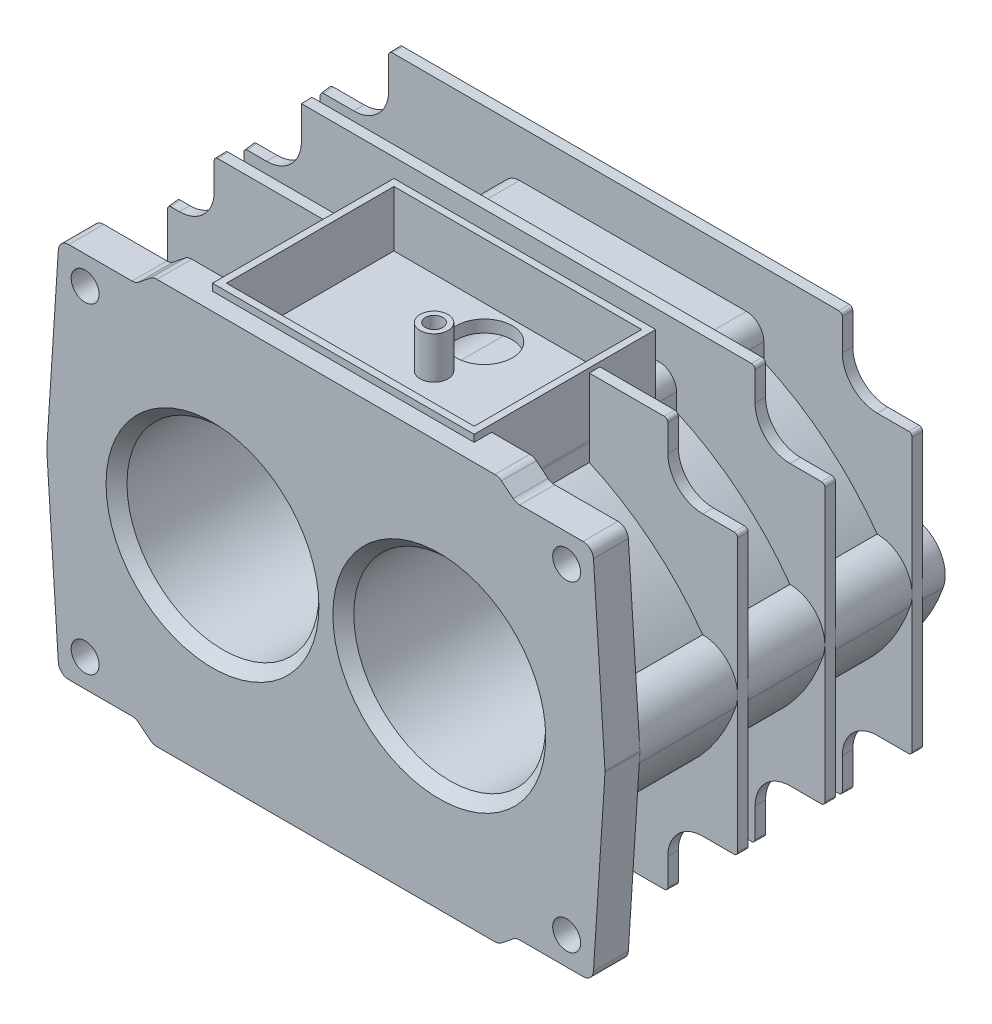
from build123d import *

# Parameters (mm, degrees)
SCHIZZO1_R                    = 27.5
SCHIZZO1_R_2                  = 4
ESTRUSIONE_ESTRUSIONE1_DEPTH  = 10
ESTRUSIONE_ESTRUSIONE2_DEPTH  = 87.5
SMUSSO1_SIZE                  = 3
SCHIZZO14_W                   = 170
SCHIZZO14_H                   = 120
ESTRUSIONE_ESTRUSIONE11_DEPTH = 3
RIPETIZIONE_A_L1_COUNT        = 3
RIPETIZIONE_A_L1_PITCH        = 25
TAGLIO_ESTRUSIONE2_DEPTH      = 62
FORO_FILETTATO_M8_1_D         = 6.8
FORO_FILETTATO_M8_1_DEPTH     = 35
FORO_FILETTATO_M8_1_TIP       = 2.042926105
SCHIZZO5_R                    = 27.5
TAGLIO_ESTRUSIONE3_DEPTH      = 197
TAGLIO_ESTRUSIONE4_DEPTH      = 197
TAGLIO_ESTRUSIONE4_DEPTH_BACK = 197
TAGLIO_ESTRUSIONE5_DEPTH      = 197
TAGLIO_ESTRUSIONE5_DEPTH_BACK = 197
SCHIZZO18_W                   = 75
SCHIZZO18_H                   = 52
ESTRUSIONE_ESTRUSIONE12_DEPTH = 18
SCHIZZO19_W                   = 71
SCHIZZO19_H                   = 48
TAGLIO_ESTRUSIONE6_DEPTH      = 16
ESTRUSIONE_ESTRUSIONE13_DEPTH = 3
RIPETIZIONE_A_L2_COUNT        = 3
RIPETIZIONE_A_L2_PITCH        = 25
SCHIZZO21_R                   = 14
ESTRUSIONE_ESTRUSIONE17_DEPTH = 13.5
TAGLIO_ESTRUSIONE7_DEPTH      = 75
FORO_FILETTATO_M24_1_D        = 21
FORO_FILETTATO_M24_1_DEPTH    = 25
FORO_FILETTATO_M24_1_TIP      = 6.3090365
SCHIZZO26_R                   = 4
ESTRUSIONE_ESTRUSIONE18_DEPTH = 12
FORO_FILETTATO_M6_1_D         = 5
FORO_FILETTATO_M6_1_DEPTH     = 12
FORO_FILETTATO_M6_1_TIP       = 1.502151548
SCHIZZO28_R                   = 8
TAGLIO_ESTRUSIONE8_DEPTH      = 12
RACCORDO11_R                  = 1
RACCORDO14_R                  = 2
RACCORDO15_R                  = 2


with BuildPart() as part:
    # Schizzo1 → Estrusione-Estrusione1 (new body)
    with BuildSketch(Plane.XY):
        with BuildLine():
            Line((-48.447656822, -58), (48.447656822, -58))
            ThreePointArc((48.447656822, -58), (49.440677646, -57.830884957), (50.321741965, -57.342606428))
            Line((50.321741965, -57.342606428), (53.678258035, -54.657393572))
            ThreePointArc((53.678258035, -54.657393572), (54.559322354, -54.169115043), (55.552343178, -54))
            Line((55.552343178, -54), (73.688149608, -54))
            ThreePointArc((73.688149608, -54), (75.739720726, -53.188848088), (76.681867953, -51.1940373))
            Line((76.681867953, -51.1940373), (79.987423508, -0.1940373))
            ThreePointArc((79.987423508, -0.1940373), (79.993705164, 0), (79.987423508, 0.1940373))
            Line((79.987423508, 0.1940373), (76.681867953, 51.1940373))
            ThreePointArc((76.681867953, 51.1940373), (75.739720726, 53.188848088), (73.688149608, 54))
            Line((73.688149608, 54), (55.552343178, 54))
            ThreePointArc((55.552343178, 54), (54.559322354, 54.169115043), (53.678258035, 54.657393572))
            Line((53.678258035, 54.657393572), (50.321741965, 57.342606428))
            ThreePointArc((50.321741965, 57.342606428), (49.440677646, 57.830884957), (48.447656822, 58))
            Line((48.447656822, 58), (-48.447656822, 58))
            ThreePointArc((-48.447656822, 58), (-49.440677646, 57.830884957), (-50.321741965, 57.342606428))
            Line((-50.321741965, 57.342606428), (-53.678258035, 54.657393572))
            ThreePointArc((-53.678258035, 54.657393572), (-54.559322354, 54.169115043), (-55.552343178, 54))
            Line((-55.552343178, 54), (-73.688149608, 54))
            ThreePointArc((-73.688149608, 54), (-75.739720726, 53.188848088), (-76.681867953, 51.1940373))
            Line((-76.681867953, 51.1940373), (-79.987423508, 0.1940373))
            ThreePointArc((-79.987423508, 0.1940373), (-79.993705164, 0), (-79.987423508, -0.1940373))
            Line((-79.987423508, -0.1940373), (-76.681867953, -51.1940373))
            ThreePointArc((-76.681867953, -51.1940373), (-75.739720726, -53.188848088), (-73.688149608, -54))
            Line((-73.688149608, -54), (-55.552343178, -54))
            ThreePointArc((-55.552343178, -54), (-54.559322354, -54.169115043), (-53.678258035, -54.657393572))
            Line((-53.678258035, -54.657393572), (-50.321741965, -57.342606428))
            ThreePointArc((-50.321741965, -57.342606428), (-49.440677646, -57.830884957), (-48.447656822, -58))
        make_face()
        with Locations((-32.5, 0)):
            Circle(SCHIZZO1_R, mode=Mode.SUBTRACT)
        with Locations((32.5, 0)):
            Circle(SCHIZZO1_R, mode=Mode.SUBTRACT)
        with Locations((-69, 46)):
            Circle(SCHIZZO1_R_2, mode=Mode.SUBTRACT)
        with Locations((-69, -46)):
            Circle(SCHIZZO1_R_2, mode=Mode.SUBTRACT)
        with Locations((69, -46)):
            Circle(SCHIZZO1_R_2, mode=Mode.SUBTRACT)
        with Locations((69, 46)):
            Circle(SCHIZZO1_R_2, mode=Mode.SUBTRACT)
    extrude(amount=-ESTRUSIONE_ESTRUSIONE1_DEPTH)

    # Schizzo3 → Estrusione-Estrusione2 (add)
    with BuildSketch(Plane.XY.offset(-97.5)):
        with BuildLine():
            Line((32.5, 46.5), (-32.5, 46.5))
            ThreePointArc((-32.5, 46.5), (-36.035533906, 45.035533906), (-37.5, 41.5))
            Line((-37.5, 41.5), (-37.5, 36.5))
            ThreePointArc((-37.5, 36.5), (-55.517237648, 25.417366926), (-70, 10))
            ThreePointArc((-70, 10), (-78.156554434, 5.785379829), (-79.437753099, -3.305876047))
            ThreePointArc((-79.437753099, -3.305876047), (-63.2803434, -25.981788278), (-37.5, -36.5))
            Line((-37.5, -36.5), (-37.5, -41.5))
            ThreePointArc((-37.5, -41.5), (-36.035533906, -45.035533906), (-32.5, -46.5))
            Line((-32.5, -46.5), (32.5, -46.5))
            ThreePointArc((32.5, -46.5), (36.035533906, -45.035533906), (37.5, -41.5))
            Line((37.5, -41.5), (37.5, -36.5))
            ThreePointArc((37.5, -36.5), (63.2803434, -25.981788278), (79.437753099, -3.305876047))
            ThreePointArc((79.437753099, -3.305876047), (78.156554434, 5.785379829), (70, 10))
            ThreePointArc((70, 10), (55.517237648, 25.417366926), (37.5, 36.5))
            Line((37.5, 36.5), (37.5, 41.5))
            ThreePointArc((37.5, 41.5), (36.035533906, 45.035533906), (32.5, 46.5))
        make_face()
    extrude(amount=ESTRUSIONE_ESTRUSIONE2_DEPTH)

    # Smusso1
    smusso1_edges = [part.edges().sort_by_distance(p)[0] for p in [
        (-60, 0, 0),
        (5, 0, 0),
    ]]
    chamfer(smusso1_edges, length=SMUSSO1_SIZE)

    # Schizzo14 → Estrusione-Estrusione11 (add)
    with BuildSketch(Plane.XY.offset(-91)):
        with Locations((-5, 0)):
            Rectangle(SCHIZZO14_W, SCHIZZO14_H)
    estrusione_estrusione11 = extrude(amount=ESTRUSIONE_ESTRUSIONE11_DEPTH)

    # Ripetizione a L1: Estrusione-Estrusione11 ×3
    with Locations(*[(0, 0, i * RIPETIZIONE_A_L1_PITCH) for i in range(1, RIPETIZIONE_A_L1_COUNT)]):
        add(estrusione_estrusione11)

    # Schizzo15 → Taglio-Estrusione2 (cut)
    with BuildSketch(Plane(origin=(0, 0, -91), x_dir=(-1, 0, 0), z_dir=(0, 0, -1))):
        with BuildLine():
            Line((-70, -40), (-80, -40))
            Line((-80, -40), (-80, -60))
            Line((-80, -60), (-60, -60))
            Line((-60, -60), (-60, -50))
            ThreePointArc((-60, -50), (-62.928932188, -42.928932188), (-70, -40))
        make_face()
        with BuildLine():
            Line((-60, 60), (-80, 60))
            Line((-80, 60), (-80, 40))
            Line((-80, 40), (-70, 40))
            ThreePointArc((-70, 40), (-62.928932188, 42.928932188), (-60, 50))
            Line((-60, 50), (-60, 60))
        make_face()
        with BuildLine():
            Line((90, -40), (80, -40))
            ThreePointArc((80, -40), (72.928932188, -42.928932188), (70, -50))
            Line((70, -50), (70, -60))
            Line((70, -60), (90, -60))
            Line((90, -60), (90, -40))
        make_face()
        with BuildLine():
            Line((70, 60), (90, 60))
            Line((90, 60), (90, 40))
            Line((90, 40), (80, 40))
            ThreePointArc((80, 40), (72.928932188, 42.928932188), (70, 50))
            Line((70, 50), (70, 60))
        make_face()
    extrude(amount=-TAGLIO_ESTRUSIONE2_DEPTH, mode=Mode.SUBTRACT)

    # Foro filettato M8-1
    with Locations(Plane(origin=(-28.5, -37.5, -97.5), x_dir=(-1, 0, 0), z_dir=(0, 0, -1))):
        with Locations((0, 0), (0, 75), (-57, 75), (-57, 0), (-98.5, 37.5), (41.5, 37.5)):
            Hole(FORO_FILETTATO_M8_1_D / 2, depth=FORO_FILETTATO_M8_1_DEPTH)
            with Locations((0, 0, -(FORO_FILETTATO_M8_1_DEPTH + FORO_FILETTATO_M8_1_TIP / 2))):  # 118° drill point
                Cone(0, FORO_FILETTATO_M8_1_D / 2, FORO_FILETTATO_M8_1_TIP, mode=Mode.SUBTRACT)

    # Schizzo5 → Taglio-Estrusione3 (cut)
    with BuildSketch(Plane.XY):
        with Locations((-32.5, 0)):
            Circle(SCHIZZO5_R)
        with Locations((32.5, 0)):
            Circle(SCHIZZO5_R)
    extrude(amount=-TAGLIO_ESTRUSIONE3_DEPTH, mode=Mode.SUBTRACT)

    # Schizzo16 → Taglio-Estrusione4 (cut, two sides: drawn at the far end of the back side and taken through both)
    with BuildSketch(Plane(origin=(0, 0, 0), x_dir=(1, 0, 0), z_dir=(0, 1, 0)).offset(-TAGLIO_ESTRUSIONE4_DEPTH_BACK)):
        with BuildLine():
            Line((-90, 91), (-79.91633228, 10))
            ThreePointArc((-79.91633228, 10), (-104.308981433, 48.091022327), (-90, 91))
        make_face()
    extrude(amount=TAGLIO_ESTRUSIONE4_DEPTH + TAGLIO_ESTRUSIONE4_DEPTH_BACK, mode=Mode.SUBTRACT)

    # Schizzo17 → Taglio-Estrusione5 (cut, two sides: drawn at the far end of the back side and taken through both)
    with BuildSketch(Plane(origin=(0, 0, 0), x_dir=(0, 0, -1), z_dir=(1, 0, 0)).offset(-TAGLIO_ESTRUSIONE5_DEPTH_BACK)):
        with BuildLine():
            Line((91, 60), (10, 58))
            ThreePointArc((10, 58), (50.02100618, 78.399249701), (91, 60))
        make_face()
        with BuildLine():
            Line((91, -60), (10, -58))
            ThreePointArc((10, -58), (50.02100618, -78.399249701), (91, -60))
        make_face()
    extrude(amount=TAGLIO_ESTRUSIONE5_DEPTH + TAGLIO_ESTRUSIONE5_DEPTH_BACK, mode=Mode.SUBTRACT)

    # Schizzo18 → Estrusione-Estrusione12 (add)
    with BuildSketch(Plane(origin=(0, 60, 0), x_dir=(1, 0, 0), z_dir=(0, 1, 0))):
        with Locations((0, 31)):
            Rectangle(SCHIZZO18_W, SCHIZZO18_H)
    extrude(amount=-ESTRUSIONE_ESTRUSIONE12_DEPTH)

    # Schizzo19 → Taglio-Estrusione6 (cut)
    with BuildSketch(Plane(origin=(0, 60, 0), x_dir=(1, 0, 0), z_dir=(0, 1, 0))):
        with Locations((0, 31)):
            Rectangle(SCHIZZO19_W, SCHIZZO19_H)
    extrude(amount=-TAGLIO_ESTRUSIONE6_DEPTH, mode=Mode.SUBTRACT)

    # Schizzo20 → Estrusione-Estrusione13 (add)
    with BuildSketch(Plane.XY.offset(-78.5)):
        with BuildLine():
            Line((30, -46.5), (-30, -46.5))
            Line((-30, -46.5), (-30, -49.5))
            ThreePointArc((-30, -49.5), (-28.535533906, -53.035533906), (-25, -54.5))
            Line((-25, -54.5), (25, -54.5))
            ThreePointArc((25, -54.5), (28.535533906, -53.035533906), (30, -49.5))
            Line((30, -49.5), (30, -46.5))
        make_face()
    estrusione_estrusione13 = extrude(amount=ESTRUSIONE_ESTRUSIONE13_DEPTH)

    # Ripetizione a L2: Estrusione-Estrusione13 ×3
    with Locations(*[(0, 0, i * RIPETIZIONE_A_L2_PITCH) for i in range(1, RIPETIZIONE_A_L2_COUNT)]):
        add(estrusione_estrusione13)

    # Schizzo21 → Estrusione-Estrusione17 (add)
    with BuildSketch(Plane(origin=(0, -60, 0), x_dir=(1, 0, 0), z_dir=(0, 1, 0))):
        with Locations(Location((0, 24.5, 0), (0, 0, 105.358885581))):
            Circle(SCHIZZO21_R)
    extrude(amount=ESTRUSIONE_ESTRUSIONE17_DEPTH)

    # Schizzo22 → Taglio-Estrusione7 (cut)
    with BuildSketch(Plane(origin=(0, 0, -97.5), x_dir=(-1, 0, 0), z_dir=(0, 0, -1))):
        with BuildLine():
            Line((-14.257337925, 40.5), (14.257337925, 40.5))
            ThreePointArc((14.257337925, 40.5), (18.31801322, 38.81801322), (20, 34.757337925))
            Line((20, 34.757337925), (20, 34.242662075))
            ThreePointArc((20, 34.242662075), (18.31801322, 30.18198678), (14.257337925, 28.5))
            Line((14.257337925, 28.5), (-14.257337925, 28.5))
            ThreePointArc((-14.257337925, 28.5), (-18.31801322, 30.18198678), (-20, 34.242662075))
            Line((-20, 34.242662075), (-20, 34.757337925))
            ThreePointArc((-20, 34.757337925), (-18.31801322, 38.81801322), (-14.257337925, 40.5))
        make_face()
        with BuildLine():
            Line((-15, -40.5), (15, -40.5))
            ThreePointArc((15, -40.5), (18.535533906, -39.035533906), (20, -35.5))
            Line((20, -35.5), (20, -34.292856399))
            ThreePointArc((20, -34.292856399), (19.264014327, -31.68169156), (17.272727273, -29.839238685))
            ThreePointArc((17.272727273, -29.839238685), (8.948926939, -23.824293434), (2.838375937, -15.570422535))
            ThreePointArc((2.838375937, -15.570422535), (2.102144972, -14.788399151), (1.067532709, -14.5))
            Line((1.067532709, -14.5), (-1.067532709, -14.5))
            ThreePointArc((-1.067532709, -14.5), (-2.102144972, -14.788399151), (-2.838375937, -15.570422535))
            ThreePointArc((-2.838375937, -15.570422535), (-8.948926939, -23.824293434), (-17.272727273, -29.839238685))
            ThreePointArc((-17.272727273, -29.839238685), (-19.264014327, -31.68169156), (-20, -34.292856399))
            Line((-20, -34.292856399), (-20, -35.5))
            ThreePointArc((-20, -35.5), (-18.535533906, -39.035533906), (-15, -40.5))
        make_face()
    extrude(amount=-TAGLIO_ESTRUSIONE7_DEPTH, mode=Mode.SUBTRACT)

    # Foro filettato M24-1
    with Locations(Plane(origin=(0, -60, -24.5), x_dir=(0, 0, -1), z_dir=(0, -1, 0))):
        with Locations((0, 0)):
            Hole(FORO_FILETTATO_M24_1_D / 2, depth=FORO_FILETTATO_M24_1_DEPTH)
            with Locations((0, 0, -(FORO_FILETTATO_M24_1_DEPTH + FORO_FILETTATO_M24_1_TIP / 2))):  # 118° drill point
                Cone(0, FORO_FILETTATO_M24_1_D / 2, FORO_FILETTATO_M24_1_TIP, mode=Mode.SUBTRACT)

    # Schizzo26 → Estrusione-Estrusione18 (add)
    with BuildSketch(Plane(origin=(0, 44, 0), x_dir=(1, 0, 0), z_dir=(0, 1, 0))):
        with Locations(Location((0, 31, 0), (0, 0, 270))):
            Circle(SCHIZZO26_R)
    extrude(amount=ESTRUSIONE_ESTRUSIONE18_DEPTH)

    # Foro filettato M6-1
    with Locations(Plane(origin=(0, 56, -31), x_dir=(0, 0, 1), z_dir=(0, 1, 0))):
        with Locations((0, 0)):
            Hole(FORO_FILETTATO_M6_1_D / 2, depth=FORO_FILETTATO_M6_1_DEPTH)
            with Locations((0, 0, -(FORO_FILETTATO_M6_1_DEPTH + FORO_FILETTATO_M6_1_TIP / 2))):  # 118° drill point
                Cone(0, FORO_FILETTATO_M6_1_D / 2, FORO_FILETTATO_M6_1_TIP, mode=Mode.SUBTRACT)

    # Schizzo28 → Taglio-Estrusione8 (cut)
    with BuildSketch(Plane(origin=(0, 44, 0), x_dir=(1, 0, 0), z_dir=(0, 1, 0))):
        with Locations(Location((0, 45.40883374, 0), (0, 0, 270))):
            Circle(SCHIZZO28_R)
    extrude(amount=-TAGLIO_ESTRUSIONE8_DEPTH, mode=Mode.SUBTRACT)

    # Raccordo11
    raccordo11_edges = [part.edges().sort_by_distance(p)[0] for p in [
        (80, -40, -64.5),
        (80, -40, -39.5),
        (80, -40, -89.5),
        (80, 40, -64.5),
        (80, 40, -39.5),
        (80, 40, -89.5),
        (-86.701022289, 40, -64.5),
        (-83.588779166, -40, -39.5),
        (-83.588779166, 40, -39.5),
        (-86.701022289, -40, -64.5),
        (-89.813265413, -40, -89.5),
        (-89.813265413, 40, -89.5),
        (60, 58.728395062, -39.5),
        (-70, 58.728395062, -39.5),
        (60, 59.345679012, -64.5),
        (60, 59.962962963, -89.5),
        (-70, 59.962962963, -89.5),
        (-70, -59.345679012, -64.5),
        (60, -58.728395062, -39.5),
        (-70, -58.728395062, -39.5),
        (60, -59.345679012, -64.5),
        (60, -59.962962963, -89.5),
        (-70, -59.962962963, -89.5),
    ]]
    fillet(raccordo11_edges, radius=RACCORDO11_R)

    # Raccordo14
    raccordo14_edges = [part.edges().sort_by_distance(p)[0] for p in [
        (37.5, 36.5, -94.25),
        (70, 10, -94.25),
        (37.5, -36.5, -94.25),
        (-37.5, -36.5, -94.25),
        (-70, 10, -94.25),
        (-37.5, 36.5, -94.25),
    ]]
    fillet(raccordo14_edges, radius=RACCORDO14_R)

    # Raccordo15
    # the kernel refuses this fillet: 2 mm, written as the material it adds along each edge
    with BuildSketch(Plane(origin=(30, -46.5, -78.5), x_dir=(0, 0, -1), z_dir=(-1, 0, 0)), Plane(origin=(30, -46.5, -53.5), x_dir=(0, 0, -1), z_dir=(-1, 0, 0))) as raccordo15_piece_1:
        with BuildLine():
            CenterArc((RACCORDO15_R, RACCORDO15_R), RACCORDO15_R, 180, 90)
            Line((0, RACCORDO15_R), (0, 0))
            Line((0, 0), (RACCORDO15_R, 0))
        make_face()
    extrude(amount=60)
    with BuildSketch(Plane(origin=(30, -46.5, -78.5), x_dir=(1, 0, 0), z_dir=(0, 0, 1)), Plane(origin=(30, -46.5, -53.5), x_dir=(1, 0, 0), z_dir=(0, 0, 1)), Plane(origin=(30, -46.5, -28.5), x_dir=(1, 0, 0), z_dir=(0, 0, 1))) as raccordo15_piece_2:
        with BuildLine():
            CenterArc((RACCORDO15_R, -RACCORDO15_R), RACCORDO15_R, 90, 90)
            Line((0, -RACCORDO15_R), (0, 0))
            Line((0, 0), (RACCORDO15_R, 0))
        make_face()
    extrude(amount=3)
    with BuildSketch(Plane(origin=(-30, -46.5, -78.5), x_dir=(-1, 0, 0), z_dir=(0, 0, 1)), Plane(origin=(-30, -46.5, -53.5), x_dir=(-1, 0, 0), z_dir=(0, 0, 1)), Plane(origin=(-30, -46.5, -28.5), x_dir=(-1, 0, 0), z_dir=(0, 0, 1))) as raccordo15_piece_3:
        with BuildLine():
            CenterArc((RACCORDO15_R, RACCORDO15_R), RACCORDO15_R, 180, 90)
            Line((0, RACCORDO15_R), (0, 0))
            Line((0, 0), (RACCORDO15_R, 0))
        make_face()
    extrude(amount=3)
    with BuildSketch(Plane(origin=(30, -46.5, -75.5), x_dir=(0, 0, 1), z_dir=(-1, 0, 0)), Plane(origin=(30, -46.5, -50.5), x_dir=(0, 0, 1), z_dir=(-1, 0, 0))) as raccordo15_piece_4:
        with BuildLine():
            CenterArc((RACCORDO15_R, -RACCORDO15_R), RACCORDO15_R, 90, 90)
            Line((0, -RACCORDO15_R), (0, 0))
            Line((0, 0), (RACCORDO15_R, 0))
        make_face()
    extrude(amount=60)
    with BuildSketch(Plane(origin=(30, -46.5, -28.5), x_dir=(0, 0, -1), z_dir=(-1, 0, 0))) as raccordo15_piece_5_section:
        with BuildLine():
            CenterArc((RACCORDO15_R, RACCORDO15_R), RACCORDO15_R, 180, 90)
            Line((0, RACCORDO15_R), (0, 0))
            Line((0, 0), (RACCORDO15_R, 0))
        make_face()
    raccordo15_piece_5 = extrude(amount=21.583592135, mode=Mode.PRIVATE)
    raccordo15_piece_5 = raccordo15_piece_5 - Plane(origin=(0, -46.5, -24.5), x_dir=(-0.2648642316849714, 0, -0.9642857142848948), z_dir=(0, -1, 0)) * Cylinder(14, 52, mode=Mode.PRIVATE)
    add(raccordo15_piece_5)
    with BuildSketch(Plane(origin=(30, -46.5, -25.5), x_dir=(0, 0, 1), z_dir=(-1, 0, 0))) as raccordo15_piece_6_section:
        with BuildLine():
            CenterArc((RACCORDO15_R, -RACCORDO15_R), RACCORDO15_R, 90, 90)
            Line((0, -RACCORDO15_R), (0, 0))
            Line((0, 0), (RACCORDO15_R, 0))
        make_face()
    raccordo15_piece_6 = extrude(amount=21.035759956, mode=Mode.PRIVATE)
    raccordo15_piece_6 = raccordo15_piece_6 - Plane(origin=(0, -46.5, -24.5), x_dir=(-0.2648642316849714, 0, -0.9642857142848948), z_dir=(0, -1, 0)) * Cylinder(14, 51, mode=Mode.PRIVATE)
    add(raccordo15_piece_6)
    with BuildSketch(Plane(origin=(-8.416407865, -46.5, -28.5), x_dir=(0, 0, -1), z_dir=(-1, 0, 0))) as raccordo15_piece_7_section:
        with BuildLine():
            CenterArc((RACCORDO15_R, RACCORDO15_R), RACCORDO15_R, 180, 90)
            Line((0, RACCORDO15_R), (0, 0))
            Line((0, 0), (RACCORDO15_R, 0))
        make_face()
    raccordo15_piece_7 = extrude(amount=21.583592135, mode=Mode.PRIVATE)
    raccordo15_piece_7 = raccordo15_piece_7 - Plane(origin=(0, -46.5, -24.5), x_dir=(-0.2648642316849714, 0, -0.9642857142848948), z_dir=(0, -1, 0)) * Cylinder(14, 52, mode=Mode.PRIVATE)
    add(raccordo15_piece_7)
    with BuildSketch(Plane(origin=(-8.964240044, -46.5, -25.5), x_dir=(0, 0, 1), z_dir=(-1, 0, 0))) as raccordo15_piece_8_section:
        with BuildLine():
            CenterArc((RACCORDO15_R, -RACCORDO15_R), RACCORDO15_R, 90, 90)
            Line((0, -RACCORDO15_R), (0, 0))
            Line((0, 0), (RACCORDO15_R, 0))
        make_face()
    raccordo15_piece_8 = extrude(amount=21.035759956, mode=Mode.PRIVATE)
    raccordo15_piece_8 = raccordo15_piece_8 - Plane(origin=(0, -46.5, -24.5), x_dir=(-0.2648642316849714, 0, -0.9642857142848948), z_dir=(0, -1, 0)) * Cylinder(14, 51, mode=Mode.PRIVATE)
    add(raccordo15_piece_8)
    with BuildSketch(Plane(origin=(0, -46.5, -24.5), x_dir=(0.9977260564148518, 0, 0.06739967619260334), z_dir=(-0.06739967619260334, 0, 0.9977260564148518))) as raccordo15_piece_9:
        with BuildLine():
            CenterArc((14 + RACCORDO15_R, -RACCORDO15_R), RACCORDO15_R, 90, 90)
            Line((14 + RACCORDO15_R, 0), (14, 0))
            Line((14, 0), (14, -RACCORDO15_R))
        make_face()
    revolve(axis=Axis((0, -46.5, -24.5), (0, 1, 0)), revolution_arc=139.904350257)
    with BuildSketch(Plane(origin=(0, -46.5, -24.5), x_dir=(-0.9092739039287061, 0, -0.4161982311762627), z_dir=(0.4161982311762627, 0, -0.9092739039287061))) as raccordo15_piece_10:
        with BuildLine():
            CenterArc((14 + RACCORDO15_R, -RACCORDO15_R), RACCORDO15_R, 90, 90)
            Line((14 + RACCORDO15_R, 0), (14, 0))
            Line((14, 0), (14, -RACCORDO15_R))
        make_face()
    revolve(axis=Axis((0, -46.5, -24.5), (0, 1, 0)), revolution_arc=229.189594995)
    with BuildSketch(Plane(origin=(0, -46.5, -24.5), x_dir=(0.719820995793835, 0, -0.6941597323486662), z_dir=(0.6941597323486662, 0, 0.719820995793835))) as raccordo15_piece_11:
        with BuildLine():
            CenterArc((14 + RACCORDO15_R, -RACCORDO15_R), RACCORDO15_R, 90, 90)
            Line((14 + RACCORDO15_R, 0), (14, 0))
            Line((14, 0), (14, -RACCORDO15_R))
        make_face()
    revolve(axis=Axis((0, -46.5, -24.5), (0, 1, 0)), revolution_arc=139.904350257)
    with BuildSketch(Plane(origin=(35, -46.5, -78.5), x_dir=(0, 0, -1), z_dir=(-1, 0, 0))) as raccordo15_piece_12a_section:
        with BuildLine():
            CenterArc((RACCORDO15_R, RACCORDO15_R), RACCORDO15_R, 180, 90)
            Line((0, RACCORDO15_R), (0, 0))
            Line((0, 0), (RACCORDO15_R, 0))
        make_face()
    raccordo15_piece_12a = extrude(amount=65, mode=Mode.PRIVATE)
    raccordo15_piece_12a = split(raccordo15_piece_12a, bisect_by=Plane(origin=(30, -46.5, -78.5), z_dir=(1, 0, 0)), keep=Keep.TOP, mode=Mode.PRIVATE)
    with BuildSketch(Plane(origin=(30, -46.5, -83.5), x_dir=(1, 0, 0), z_dir=(0, 0, 1))) as raccordo15_piece_12b_section:
        with BuildLine():
            CenterArc((RACCORDO15_R, -RACCORDO15_R), RACCORDO15_R, 90, 90)
            Line((0, -RACCORDO15_R), (0, 0))
            Line((0, 0), (RACCORDO15_R, 0))
        make_face()
    raccordo15_piece_12b = extrude(amount=8, mode=Mode.PRIVATE)
    raccordo15_piece_12b = split(raccordo15_piece_12b, bisect_by=Plane(origin=(30, -46.5, -78.5), z_dir=(0, 0, -1)), keep=Keep.TOP, mode=Mode.PRIVATE)
    raccordo15_piece_12 = raccordo15_piece_12a & raccordo15_piece_12b
    add(raccordo15_piece_12)
    with BuildSketch(Plane(origin=(30, -46.5, -78.5), x_dir=(0, 0, -1), z_dir=(-1, 0, 0))) as raccordo15_piece_13a_section:
        with BuildLine():
            CenterArc((RACCORDO15_R, RACCORDO15_R), RACCORDO15_R, 180, 90)
            Line((0, RACCORDO15_R), (0, 0))
            Line((0, 0), (RACCORDO15_R, 0))
        make_face()
    raccordo15_piece_13a = extrude(amount=65, mode=Mode.PRIVATE)
    raccordo15_piece_13a = split(raccordo15_piece_13a, bisect_by=Plane(origin=(-30, -46.5, -78.5), z_dir=(-1, 0, 0)), keep=Keep.TOP, mode=Mode.PRIVATE)
    with BuildSketch(Plane(origin=(-30, -46.5, -83.5), x_dir=(-1, 0, 0), z_dir=(0, 0, 1))) as raccordo15_piece_13b_section:
        with BuildLine():
            CenterArc((RACCORDO15_R, RACCORDO15_R), RACCORDO15_R, 180, 90)
            Line((0, RACCORDO15_R), (0, 0))
            Line((0, 0), (RACCORDO15_R, 0))
        make_face()
    raccordo15_piece_13b = extrude(amount=8, mode=Mode.PRIVATE)
    raccordo15_piece_13b = split(raccordo15_piece_13b, bisect_by=Plane(origin=(-30, -46.5, -78.5), z_dir=(0, 0, -1)), keep=Keep.TOP, mode=Mode.PRIVATE)
    raccordo15_piece_13 = raccordo15_piece_13a & raccordo15_piece_13b
    add(raccordo15_piece_13)
    with BuildSketch(Plane(origin=(35, -46.5, -75.5), x_dir=(0, 0, 1), z_dir=(-1, 0, 0))) as raccordo15_piece_14a_section:
        with BuildLine():
            CenterArc((RACCORDO15_R, -RACCORDO15_R), RACCORDO15_R, 90, 90)
            Line((0, -RACCORDO15_R), (0, 0))
            Line((0, 0), (RACCORDO15_R, 0))
        make_face()
    raccordo15_piece_14a = extrude(amount=65, mode=Mode.PRIVATE)
    raccordo15_piece_14a = split(raccordo15_piece_14a, bisect_by=Plane(origin=(30, -46.5, -75.5), z_dir=(1, 0, 0)), keep=Keep.TOP, mode=Mode.PRIVATE)
    with BuildSketch(Plane(origin=(30, -46.5, -78.5), x_dir=(1, 0, 0), z_dir=(0, 0, 1))) as raccordo15_piece_14b_section:
        with BuildLine():
            CenterArc((RACCORDO15_R, -RACCORDO15_R), RACCORDO15_R, 90, 90)
            Line((0, -RACCORDO15_R), (0, 0))
            Line((0, 0), (RACCORDO15_R, 0))
        make_face()
    raccordo15_piece_14b = extrude(amount=8, mode=Mode.PRIVATE)
    raccordo15_piece_14b = split(raccordo15_piece_14b, bisect_by=Plane(origin=(30, -46.5, -75.5), z_dir=(0, 0, 1)), keep=Keep.TOP, mode=Mode.PRIVATE)
    raccordo15_piece_14 = raccordo15_piece_14a & raccordo15_piece_14b
    add(raccordo15_piece_14)
    with BuildSketch(Plane(origin=(-30, -46.5, -78.5), x_dir=(-1, 0, 0), z_dir=(0, 0, 1))) as raccordo15_piece_15a_section:
        with BuildLine():
            CenterArc((RACCORDO15_R, RACCORDO15_R), RACCORDO15_R, 180, 90)
            Line((0, RACCORDO15_R), (0, 0))
            Line((0, 0), (RACCORDO15_R, 0))
        make_face()
    raccordo15_piece_15a = extrude(amount=8, mode=Mode.PRIVATE)
    raccordo15_piece_15a = split(raccordo15_piece_15a, bisect_by=Plane(origin=(-30, -46.5, -75.5), z_dir=(0, 0, 1)), keep=Keep.TOP, mode=Mode.PRIVATE)
    with BuildSketch(Plane(origin=(30, -46.5, -75.5), x_dir=(0, 0, 1), z_dir=(-1, 0, 0))) as raccordo15_piece_15b_section:
        with BuildLine():
            CenterArc((RACCORDO15_R, -RACCORDO15_R), RACCORDO15_R, 90, 90)
            Line((0, -RACCORDO15_R), (0, 0))
            Line((0, 0), (RACCORDO15_R, 0))
        make_face()
    raccordo15_piece_15b = extrude(amount=65, mode=Mode.PRIVATE)
    raccordo15_piece_15b = split(raccordo15_piece_15b, bisect_by=Plane(origin=(-30, -46.5, -75.5), z_dir=(-1, 0, 0)), keep=Keep.TOP, mode=Mode.PRIVATE)
    raccordo15_piece_15 = raccordo15_piece_15a & raccordo15_piece_15b
    add(raccordo15_piece_15)
    with BuildSketch(Plane(origin=(35, -46.5, -53.5), x_dir=(0, 0, -1), z_dir=(-1, 0, 0))) as raccordo15_piece_16a_section:
        with BuildLine():
            CenterArc((RACCORDO15_R, RACCORDO15_R), RACCORDO15_R, 180, 90)
            Line((0, RACCORDO15_R), (0, 0))
            Line((0, 0), (RACCORDO15_R, 0))
        make_face()
    raccordo15_piece_16a = extrude(amount=65, mode=Mode.PRIVATE)
    raccordo15_piece_16a = split(raccordo15_piece_16a, bisect_by=Plane(origin=(30, -46.5, -53.5), z_dir=(1, 0, 0)), keep=Keep.TOP, mode=Mode.PRIVATE)
    with BuildSketch(Plane(origin=(30, -46.5, -58.5), x_dir=(1, 0, 0), z_dir=(0, 0, 1))) as raccordo15_piece_16b_section:
        with BuildLine():
            CenterArc((RACCORDO15_R, -RACCORDO15_R), RACCORDO15_R, 90, 90)
            Line((0, -RACCORDO15_R), (0, 0))
            Line((0, 0), (RACCORDO15_R, 0))
        make_face()
    raccordo15_piece_16b = extrude(amount=8, mode=Mode.PRIVATE)
    raccordo15_piece_16b = split(raccordo15_piece_16b, bisect_by=Plane(origin=(30, -46.5, -53.5), z_dir=(0, 0, -1)), keep=Keep.TOP, mode=Mode.PRIVATE)
    raccordo15_piece_16 = raccordo15_piece_16a & raccordo15_piece_16b
    add(raccordo15_piece_16)
    with BuildSketch(Plane(origin=(30, -46.5, -53.5), x_dir=(0, 0, -1), z_dir=(-1, 0, 0))) as raccordo15_piece_17a_section:
        with BuildLine():
            CenterArc((RACCORDO15_R, RACCORDO15_R), RACCORDO15_R, 180, 90)
            Line((0, RACCORDO15_R), (0, 0))
            Line((0, 0), (RACCORDO15_R, 0))
        make_face()
    raccordo15_piece_17a = extrude(amount=65, mode=Mode.PRIVATE)
    raccordo15_piece_17a = split(raccordo15_piece_17a, bisect_by=Plane(origin=(-30, -46.5, -53.5), z_dir=(-1, 0, 0)), keep=Keep.TOP, mode=Mode.PRIVATE)
    with BuildSketch(Plane(origin=(-30, -46.5, -58.5), x_dir=(-1, 0, 0), z_dir=(0, 0, 1))) as raccordo15_piece_17b_section:
        with BuildLine():
            CenterArc((RACCORDO15_R, RACCORDO15_R), RACCORDO15_R, 180, 90)
            Line((0, RACCORDO15_R), (0, 0))
            Line((0, 0), (RACCORDO15_R, 0))
        make_face()
    raccordo15_piece_17b = extrude(amount=8, mode=Mode.PRIVATE)
    raccordo15_piece_17b = split(raccordo15_piece_17b, bisect_by=Plane(origin=(-30, -46.5, -53.5), z_dir=(0, 0, -1)), keep=Keep.TOP, mode=Mode.PRIVATE)
    raccordo15_piece_17 = raccordo15_piece_17a & raccordo15_piece_17b
    add(raccordo15_piece_17)
    with BuildSketch(Plane(origin=(35, -46.5, -50.5), x_dir=(0, 0, 1), z_dir=(-1, 0, 0))) as raccordo15_piece_18a_section:
        with BuildLine():
            CenterArc((RACCORDO15_R, -RACCORDO15_R), RACCORDO15_R, 90, 90)
            Line((0, -RACCORDO15_R), (0, 0))
            Line((0, 0), (RACCORDO15_R, 0))
        make_face()
    raccordo15_piece_18a = extrude(amount=65, mode=Mode.PRIVATE)
    raccordo15_piece_18a = split(raccordo15_piece_18a, bisect_by=Plane(origin=(30, -46.5, -50.5), z_dir=(1, 0, 0)), keep=Keep.TOP, mode=Mode.PRIVATE)
    with BuildSketch(Plane(origin=(30, -46.5, -53.5), x_dir=(1, 0, 0), z_dir=(0, 0, 1))) as raccordo15_piece_18b_section:
        with BuildLine():
            CenterArc((RACCORDO15_R, -RACCORDO15_R), RACCORDO15_R, 90, 90)
            Line((0, -RACCORDO15_R), (0, 0))
            Line((0, 0), (RACCORDO15_R, 0))
        make_face()
    raccordo15_piece_18b = extrude(amount=8, mode=Mode.PRIVATE)
    raccordo15_piece_18b = split(raccordo15_piece_18b, bisect_by=Plane(origin=(30, -46.5, -50.5), z_dir=(0, 0, 1)), keep=Keep.TOP, mode=Mode.PRIVATE)
    raccordo15_piece_18 = raccordo15_piece_18a & raccordo15_piece_18b
    add(raccordo15_piece_18)
    with BuildSketch(Plane(origin=(-30, -46.5, -53.5), x_dir=(-1, 0, 0), z_dir=(0, 0, 1))) as raccordo15_piece_19a_section:
        with BuildLine():
            CenterArc((RACCORDO15_R, RACCORDO15_R), RACCORDO15_R, 180, 90)
            Line((0, RACCORDO15_R), (0, 0))
            Line((0, 0), (RACCORDO15_R, 0))
        make_face()
    raccordo15_piece_19a = extrude(amount=8, mode=Mode.PRIVATE)
    raccordo15_piece_19a = split(raccordo15_piece_19a, bisect_by=Plane(origin=(-30, -46.5, -50.5), z_dir=(0, 0, 1)), keep=Keep.TOP, mode=Mode.PRIVATE)
    with BuildSketch(Plane(origin=(30, -46.5, -50.5), x_dir=(0, 0, 1), z_dir=(-1, 0, 0))) as raccordo15_piece_19b_section:
        with BuildLine():
            CenterArc((RACCORDO15_R, -RACCORDO15_R), RACCORDO15_R, 90, 90)
            Line((0, -RACCORDO15_R), (0, 0))
            Line((0, 0), (RACCORDO15_R, 0))
        make_face()
    raccordo15_piece_19b = extrude(amount=65, mode=Mode.PRIVATE)
    raccordo15_piece_19b = split(raccordo15_piece_19b, bisect_by=Plane(origin=(-30, -46.5, -50.5), z_dir=(-1, 0, 0)), keep=Keep.TOP, mode=Mode.PRIVATE)
    raccordo15_piece_19 = raccordo15_piece_19a & raccordo15_piece_19b
    add(raccordo15_piece_19)
    with BuildSketch(Plane(origin=(30, -46.5, -33.5), x_dir=(1, 0, 0), z_dir=(0, 0, 1))) as raccordo15_piece_20a_section:
        with BuildLine():
            CenterArc((RACCORDO15_R, -RACCORDO15_R), RACCORDO15_R, 90, 90)
            Line((0, -RACCORDO15_R), (0, 0))
            Line((0, 0), (RACCORDO15_R, 0))
        make_face()
    raccordo15_piece_20a = extrude(amount=8, mode=Mode.PRIVATE)
    raccordo15_piece_20a = split(raccordo15_piece_20a, bisect_by=Plane(origin=(30, -46.5, -28.5), z_dir=(0, 0, -1)), keep=Keep.TOP, mode=Mode.PRIVATE)
    with BuildSketch(Plane(origin=(35, -46.5, -28.5), x_dir=(0, 0, -1), z_dir=(-1, 0, 0))) as raccordo15_piece_20b_section:
        with BuildLine():
            CenterArc((RACCORDO15_R, RACCORDO15_R), RACCORDO15_R, 180, 90)
            Line((0, RACCORDO15_R), (0, 0))
            Line((0, 0), (RACCORDO15_R, 0))
        make_face()
    raccordo15_piece_20b = extrude(amount=26.583592135, mode=Mode.PRIVATE)
    raccordo15_piece_20b = split(raccordo15_piece_20b, bisect_by=Plane(origin=(30, -46.5, -28.5), z_dir=(1, 0, 0)), keep=Keep.TOP, mode=Mode.PRIVATE)
    raccordo15_piece_20 = raccordo15_piece_20a & raccordo15_piece_20b
    add(raccordo15_piece_20)
    with BuildSketch(Plane(origin=(35, -46.5, -25.5), x_dir=(0, 0, 1), z_dir=(-1, 0, 0))) as raccordo15_piece_21a_section:
        with BuildLine():
            CenterArc((RACCORDO15_R, -RACCORDO15_R), RACCORDO15_R, 90, 90)
            Line((0, -RACCORDO15_R), (0, 0))
            Line((0, 0), (RACCORDO15_R, 0))
        make_face()
    raccordo15_piece_21a = extrude(amount=26.035759956, mode=Mode.PRIVATE)
    raccordo15_piece_21a = split(raccordo15_piece_21a, bisect_by=Plane(origin=(30, -46.5, -25.5), z_dir=(1, 0, 0)), keep=Keep.TOP, mode=Mode.PRIVATE)
    with BuildSketch(Plane(origin=(30, -46.5, -28.5), x_dir=(1, 0, 0), z_dir=(0, 0, 1))) as raccordo15_piece_21b_section:
        with BuildLine():
            CenterArc((RACCORDO15_R, -RACCORDO15_R), RACCORDO15_R, 90, 90)
            Line((0, -RACCORDO15_R), (0, 0))
            Line((0, 0), (RACCORDO15_R, 0))
        make_face()
    raccordo15_piece_21b = extrude(amount=8, mode=Mode.PRIVATE)
    raccordo15_piece_21b = split(raccordo15_piece_21b, bisect_by=Plane(origin=(30, -46.5, -25.5), z_dir=(0, 0, 1)), keep=Keep.TOP, mode=Mode.PRIVATE)
    raccordo15_piece_21 = raccordo15_piece_21a & raccordo15_piece_21b
    add(raccordo15_piece_21)
    with BuildSketch(Plane(origin=(-8.416407865, -46.5, -28.5), x_dir=(0, 0, -1), z_dir=(-1, 0, 0))) as raccordo15_piece_22a_section:
        with BuildLine():
            CenterArc((RACCORDO15_R, RACCORDO15_R), RACCORDO15_R, 180, 90)
            Line((0, RACCORDO15_R), (0, 0))
            Line((0, 0), (RACCORDO15_R, 0))
        make_face()
    raccordo15_piece_22a = extrude(amount=26.583592135, mode=Mode.PRIVATE)
    raccordo15_piece_22a = split(raccordo15_piece_22a, bisect_by=Plane(origin=(-30, -46.5, -28.5), z_dir=(-1, 0, 0)), keep=Keep.TOP, mode=Mode.PRIVATE)
    with BuildSketch(Plane(origin=(-30, -46.5, -33.5), x_dir=(-1, 0, 0), z_dir=(0, 0, 1))) as raccordo15_piece_22b_section:
        with BuildLine():
            CenterArc((RACCORDO15_R, RACCORDO15_R), RACCORDO15_R, 180, 90)
            Line((0, RACCORDO15_R), (0, 0))
            Line((0, 0), (RACCORDO15_R, 0))
        make_face()
    raccordo15_piece_22b = extrude(amount=8, mode=Mode.PRIVATE)
    raccordo15_piece_22b = split(raccordo15_piece_22b, bisect_by=Plane(origin=(-30, -46.5, -28.5), z_dir=(0, 0, -1)), keep=Keep.TOP, mode=Mode.PRIVATE)
    raccordo15_piece_22 = raccordo15_piece_22a & raccordo15_piece_22b
    add(raccordo15_piece_22)
    with BuildSketch(Plane(origin=(-30, -46.5, -28.5), x_dir=(-1, 0, 0), z_dir=(0, 0, 1))) as raccordo15_piece_23a_section:
        with BuildLine():
            CenterArc((RACCORDO15_R, RACCORDO15_R), RACCORDO15_R, 180, 90)
            Line((0, RACCORDO15_R), (0, 0))
            Line((0, 0), (RACCORDO15_R, 0))
        make_face()
    raccordo15_piece_23a = extrude(amount=8, mode=Mode.PRIVATE)
    raccordo15_piece_23a = split(raccordo15_piece_23a, bisect_by=Plane(origin=(-30, -46.5, -25.5), z_dir=(0, 0, 1)), keep=Keep.TOP, mode=Mode.PRIVATE)
    with BuildSketch(Plane(origin=(-8.964240044, -46.5, -25.5), x_dir=(0, 0, 1), z_dir=(-1, 0, 0))) as raccordo15_piece_23b_section:
        with BuildLine():
            CenterArc((RACCORDO15_R, -RACCORDO15_R), RACCORDO15_R, 90, 90)
            Line((0, -RACCORDO15_R), (0, 0))
            Line((0, 0), (RACCORDO15_R, 0))
        make_face()
    raccordo15_piece_23b = extrude(amount=26.035759956, mode=Mode.PRIVATE)
    raccordo15_piece_23b = split(raccordo15_piece_23b, bisect_by=Plane(origin=(-30, -46.5, -25.5), z_dir=(-1, 0, 0)), keep=Keep.TOP, mode=Mode.PRIVATE)
    raccordo15_piece_23 = raccordo15_piece_23a & raccordo15_piece_23b
    add(raccordo15_piece_23)


solid = part.part
